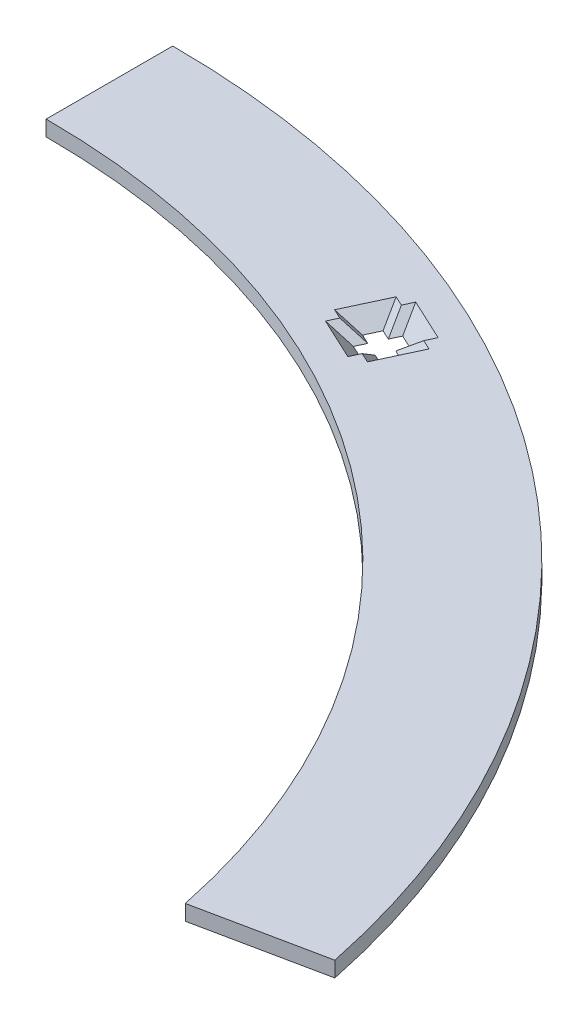
from build123d import *

# Parameters (mm, degrees)
BOSS_EXTRUDE1_DEPTH = 1
CUT_EXTRUDE2_DEPTH  = 84.653220646
CUT_EXTRUDE1_DEPTH  = 81.785527353
CHAMFER1_SIZE       = 1


with BuildPart() as part:
    # Sketch1 → Boss-Extrude1 (new body)
    with BuildSketch(Plane(origin=(0, 0, 0), x_dir=(1, 0, 0), z_dir=(0, 1, 0))):
        with BuildLine():
            Line((0, 49.519034561), (0, 59.764352058))
            ThreePointArc((0, 59.764352058), (37.735444373, 46.3445144), (58.524213344, 12.111739322))
            Line((58.524213344, 12.111739322), (48.491491054, 10.03544116))
            ThreePointArc((48.491491054, 10.03544116), (31.266511048, 38.399740504), (0, 49.519034561))
        make_face()
    extrude(amount=BOSS_EXTRUDE1_DEPTH)

    # Sketch3 → Cut-Extrude2 (cut, through all)
    with BuildSketch(Plane(origin=(0, 1, 0), x_dir=(1, 0, 0), z_dir=(0, 1, 0))):
        with BuildLine():
            ThreePointArc((0, 57.715288559), (36.441657708, 44.75555962), (56.517668886, 11.69647969))
            Line((56.517668886, 11.69647969), (58.524213344, 12.111739322))
            ThreePointArc((58.524213344, 12.111739322), (37.735444373, 46.3445144), (0, 59.764352058))
            Line((0, 59.764352058), (0, 57.715288559))
        make_face()
    extrude(amount=-CUT_EXTRUDE2_DEPTH, mode=Mode.SUBTRACT)

    # Sketch2 → Cut-Extrude1 (cut, through all)
    with BuildSketch(Plane(origin=(0, 1, 0), x_dir=(1, 0, 0), z_dir=(0, 1, 0))):
        Polygon((23.166733532, 49.681220385), (22.870900749, 49.046804934), (23.324054642, 48.835495803), (23.619887426, 49.469911254), align=None)
        Polygon((22.417746855, 49.258114065), (22.870900749, 49.046804934), (23.166733532, 49.681220385), (22.713579639, 49.892529516), align=None)
        Polygon((22.206437724, 48.804960172), (22.659591618, 48.593651041), (22.870900749, 49.046804934), (22.417746855, 49.258114065), align=None)
        Polygon((21.360713143, 48.647639061), (21.995128594, 48.351806278), (22.206437724, 48.804960172), (22.417746855, 49.258114065), (21.783331404, 49.553946848), align=None)
        Polygon((21.995128594, 48.351806278), (22.448282487, 48.140497147), (22.659591618, 48.593651041), (22.206437724, 48.804960172), align=None)
        Polygon((21.69929581, 47.717390827), (22.152449704, 47.506081696), (22.448282487, 48.140497147), (21.995128594, 48.351806278), align=None)
        Polygon((22.448282487, 48.140497147), (22.152449704, 47.506081696), (22.605603597, 47.294772565), (22.901436381, 47.929188016), align=None)
        Polygon((22.659591618, 48.593651041), (22.448282487, 48.140497147), (22.901436381, 47.929188016), (23.112745512, 48.38234191), align=None)
        Polygon((23.112745512, 48.38234191), (22.901436381, 47.929188016), (23.535851832, 47.633355233), (23.958470093, 48.53966302), (23.324054642, 48.835495803), align=None)
        Polygon((22.870900749, 49.046804934), (22.659591618, 48.593651041), (23.112745512, 48.38234191), (23.324054642, 48.835495803), align=None)
    extrude(amount=-CUT_EXTRUDE1_DEPTH, mode=Mode.SUBTRACT)

    # Chamfer1
    chamfer1_edges = [part.edges().sort_by_distance(p)[0] for p in [
        (21.847212202, 1, -48.034598553),
        (22.152449704, 1, -47.506081696),
        (22.753519989, 1, -47.611980291),
        (23.218644106, 1, -47.781271625),
        (23.747160962, 1, -48.086509127),
        (23.641262368, 1, -48.687579412),
        (23.471971034, 1, -49.152703529),
        (23.166733532, 1, -49.681220385),
        (22.565663247, 1, -49.575321791),
        (22.10053913, 1, -49.406030457),
        (21.572022274, 1, -49.100792955),
        (21.677920868, 1, -48.49972267),
    ]]
    chamfer(chamfer1_edges, length=CHAMFER1_SIZE - 0.0001)  # a hair under: the kernel refuses the full size


solid = part.part
